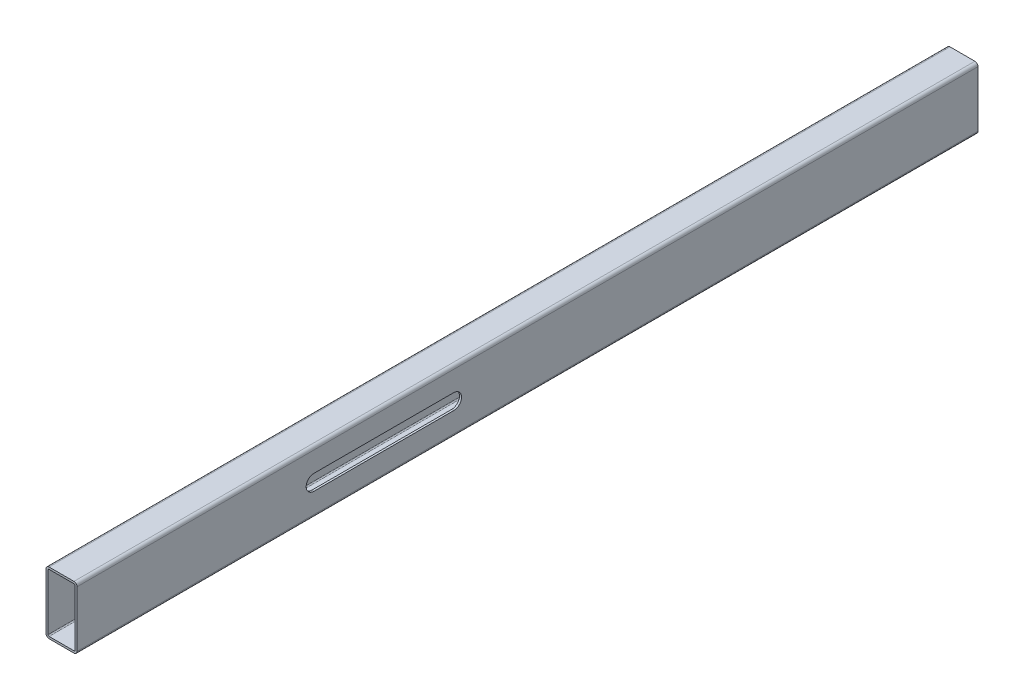
from build123d import *

# Parameters (mm, degrees)
EXTRUDE_THIN1_DEPTH = 736.6
CUT_EXTRUDE2_DEPTH  = 738.475341961


with BuildPart() as part:
    # Sketch1 → Extrude-Thin1 (new body)
    with BuildSketch(Plane.XY):
        with BuildLine():
            Line((-10.16, 25.4), (10.16, 25.4))
            ThreePointArc((10.16, 25.4), (11.956051224, 24.656051224), (12.7, 22.86))
            Line((12.7, 22.86), (12.7, -22.86))
            ThreePointArc((12.7, -22.86), (11.956051224, -24.656051224), (10.16, -25.4))
            Line((10.16, -25.4), (-10.16, -25.4))
            ThreePointArc((-10.16, -25.4), (-11.956051224, -24.656051224), (-12.7, -22.86))
            Line((-12.7, -22.86), (-12.7, 22.86))
            ThreePointArc((-12.7, 22.86), (-11.956051224, 24.656051224), (-10.16, 25.4))
        make_face()
        with BuildLine():
            Line((-10.16, 23.749), (10.16, 23.749))
            ThreePointArc((10.16, 23.749), (10.788617928, 23.488617928), (11.049, 22.86))
            Line((11.049, 22.86), (11.049, -22.86))
            ThreePointArc((11.049, -22.86), (10.788617928, -23.488617928), (10.16, -23.749))
            Line((10.16, -23.749), (-10.16, -23.749))
            ThreePointArc((-10.16, -23.749), (-10.788617928, -23.488617928), (-11.049, -22.86))
            Line((-11.049, -22.86), (-11.049, 22.86))
            ThreePointArc((-11.049, 22.86), (-10.788617928, 23.488617928), (-10.16, 23.749))
        make_face(mode=Mode.SUBTRACT)
    extrude(amount=EXTRUDE_THIN1_DEPTH)

    # Sketch3 → Cut-Extrude2 (cut, through all)
    with BuildSketch(Plane.ZY.offset(12.7)):
        with BuildLine():
            Line((542.925, -6.35), (428.625, -6.35))
            ThreePointArc((428.625, -6.35), (422.275, 0), (428.625, 6.35))
            Line((428.625, 6.35), (542.925, 6.35))
            ThreePointArc((542.925, 6.35), (549.275, 0), (542.925, -6.35))
        make_face()
    extrude(amount=-CUT_EXTRUDE2_DEPTH, mode=Mode.SUBTRACT)


solid = part.part
